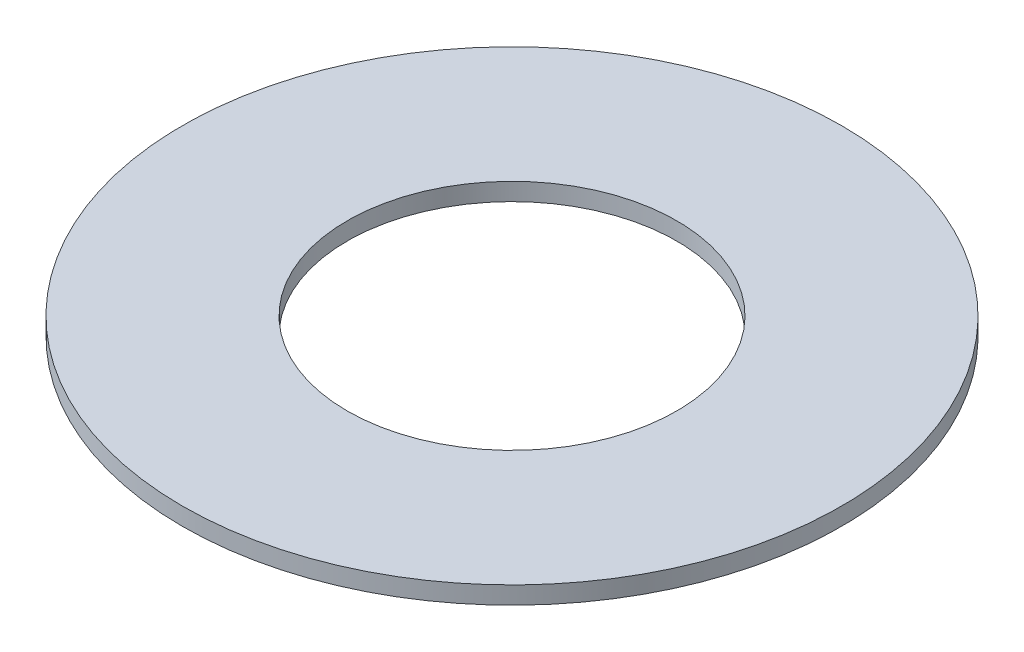
from build123d import *

# Parameters (mm, degrees)
SKETCH1_R           = 75
BOSS_EXTRUDE1_DEPTH = 4
SKETCH2_R           = 37.5
CUT_EXTRUDE1_DEPTH  = 107.141415103


with BuildPart() as part:
    # Sketch1 → Boss-Extrude1 (new body)
    with BuildSketch(Plane(origin=(0, 0, 0), x_dir=(1, 0, 0), z_dir=(0, 1, 0))):
        Circle(SKETCH1_R)
    extrude(amount=BOSS_EXTRUDE1_DEPTH)

    # Sketch2 → Cut-Extrude1 (cut, through all)
    with BuildSketch(Plane(origin=(0, 0, 0), x_dir=(1, 0, 0), z_dir=(0, 1, 0))):
        Circle(SKETCH2_R)
    extrude(amount=CUT_EXTRUDE1_DEPTH, mode=Mode.SUBTRACT)


solid = part.part
